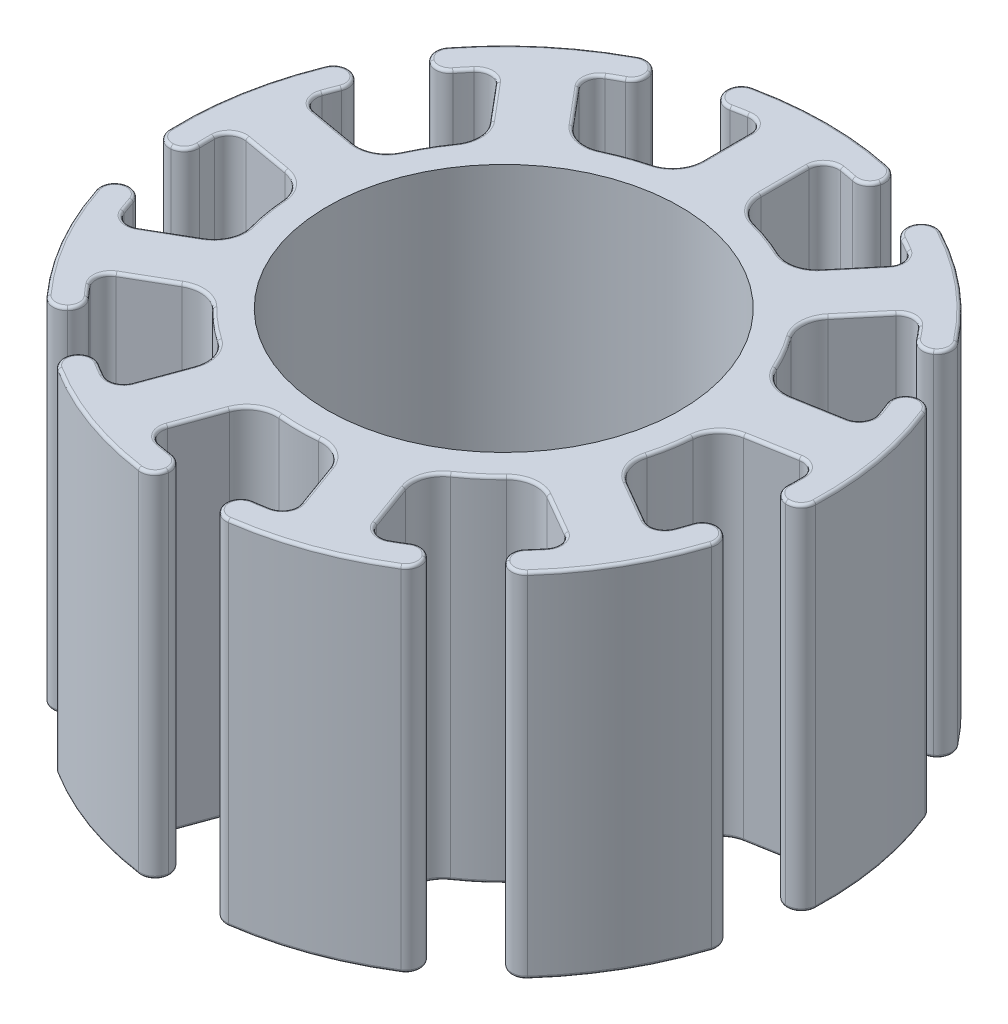
from build123d import *

# Parameters (mm, degrees)
SKETCH1_R                = 3.5
BOSS_EXTRUDE1_DEPTH      = 3
BOSS_EXTRUDE2_DEPTH      = 6
FILLET1_R                = 0.25
CIRPATTERN1_COUNT        = 9
FILLET1_OF_CIRPATTERN1_R = 0.25
FILLET2_R                = 0.5
SKETCH3_R                = 3
CUT_EXTRUDE1_DEPTH       = 10.823441352
FILLET3_R                = 0.05


with BuildPart() as part:
    # Sketch1 → Boss-Extrude1 (new, symmetric)
    with BuildSketch(Plane(origin=(0, 0, 0), x_dir=(1, 0, 0), z_dir=(0, 1, 0))):
        with Locations(Location((0, 0, 0), (0, 0, 270))):
            Circle(SKETCH1_R)
    extrude(amount=BOSS_EXTRUDE1_DEPTH, both=True)

    # Sketch2 → Boss-Extrude2 (add)
    with BuildSketch(Plane(origin=(0, 3, 0), x_dir=(1, 0, 0), z_dir=(0, 1, 0))):
        with BuildLine():
            Line((-1.4, 5.318834459), (-1.272727273, 4.835304053))
            ThreePointArc((-1.272727273, 4.835304053), (-0.88910902, 4.920313522), (-0.5, 4.974937186))
            Line((-0.5, 4.974937186), (-0.5, 3.464101615))
            ThreePointArc((-0.5, 3.464101615), (0, 3.5), (0.5, 3.464101615))
            Line((0.5, 3.464101615), (0.5, 4.974937186))
            ThreePointArc((0.5, 4.974937186), (0.88910902, 4.920313522), (1.272727273, 4.835304053))
            Line((1.272727273, 4.835304053), (1.4, 5.318834459))
            ThreePointArc((1.4, 5.318834459), (0, 5.5), (-1.4, 5.318834459))
        make_face()
    boss_extrude2 = extrude(amount=-BOSS_EXTRUDE2_DEPTH)

    # Fillet1
    fillet1_edges = [part.edges().sort_by_distance(p)[0] for p in [
        (-0.5, 0, -4.974937186),
        (0.5, 0, -4.974937186),
        (1.4, 0, -5.318834459),
        (1.272727273, 0, -4.835304053),
        (-1.4, 0, -5.318834459),
        (-1.272727273, 0, -4.835304053),
    ]]
    fillet(fillet1_edges, radius=FILLET1_R - 0.0001)  # a hair under: the kernel refuses the full size

    # CirPattern1: Boss-Extrude2 ×9 about axis
    cirpattern1_axis = Axis((0, 0, 0), (0, 1, 0))
    for i in range(1, CIRPATTERN1_COUNT):
        add(boss_extrude2.rotate(cirpattern1_axis, i * 360 / CIRPATTERN1_COUNT))

    # Fillet1 of CirPattern1
    fillet1_of_cirpattern1_edges = [part.edges().sort_by_distance(p)[0] for p in [
        (-3.580850203, 0, -3.489629181),
        (-2.81480576, 0, -4.132416791),
        (-2.346418668, 0, -4.974366235),
        (-2.13310788, 0, -4.522151122),
        (-4.491343108, 0, -3.174560927),
        (-4.083039189, 0, -2.88596448),
        (-4.9861808, 0, -0.3714849),
        (-4.812532622, 0, -1.356292653),
        (-4.994921963, 0, -2.302336765),
        (-4.540838148, 0, -2.093033423),
        (-5.481136861, 0, 0.455124943),
        (-4.982851692, 0, 0.413749948),
        (-4.058421985, 0, 2.920481295),
        (-4.558421985, 0, 2.054455891),
        (-5.30624576, 0, 1.446981664),
        (-4.823859782, 0, 1.315437876),
        (-3.90624576, 0, 3.871852795),
        (-3.551132509, 0, 3.519866177),
        (-1.231682419, 0, 4.845921834),
        (-2.17137504, 0, 4.50390169),
        (-3.134718193, 0, 4.519241291),
        (-2.849743812, 0, 4.108401174),
        (-0.503578855, 0, 5.476897693),
        (-0.457798959, 0, 4.978997903),
        (2.17137504, 0, 4.50390169),
        (1.231682419, 0, 4.845921834),
        (0.503578855, 0, 5.476897693),
        (0.457798959, 0, 4.978997903),
        (3.134718193, 0, 4.519241291),
        (2.849743812, 0, 4.108401174),
        (4.558421985, 0, 2.054455891),
        (4.058421985, 0, 2.920481295),
        (3.90624576, 0, 3.871852795),
        (3.551132509, 0, 3.519866177),
        (5.30624576, 0, 1.446981664),
        (4.823859782, 0, 1.315437876),
        (4.812532622, 0, -1.356292653),
        (4.9861808, 0, -0.3714849),
        (5.481136861, 0, 0.455124943),
        (4.982851692, 0, 0.413749948),
        (4.994921963, 0, -2.302336765),
        (4.540838148, 0, -2.093033423),
        (2.81480576, 0, -4.132416791),
        (3.580850203, 0, -3.489629181),
        (4.491343108, 0, -3.174560927),
        (4.083039189, 0, -2.88596448),
        (2.346418668, 0, -4.974366235),
        (2.13310788, 0, -4.522151122),
    ]]
    fillet(fillet1_of_cirpattern1_edges, radius=FILLET1_OF_CIRPATTERN1_R - 0.0001)  # a hair under: the kernel refuses the full size

    # Fillet2
    fillet2_edges = [part.edges().sort_by_distance(p)[0] for p in [
        (0.714946221, 0, 3.426200797),
        (1.654638841, 0, 3.084180654),
        (-1.654638841, 0, 3.084180654),
        (-0.714946221, 0, 3.426200797),
        (-3.25, 0, 1.299038106),
        (-2.75, 0, 2.165063509),
        (-3.324650039, 0, -1.093938809),
        (-3.498298217, 0, -0.109131056),
        (-1.843659375, 0, -2.975049598),
        (-2.609703818, 0, -2.332261988),
        (2.609703818, 0, -2.332261988),
        (1.843659375, 0, -2.975049598),
        (0.5, 0, -3.464101615),
        (-0.5, 0, -3.464101615),
        (3.498298217, 0, -0.109131056),
        (3.324650039, 0, -1.093938809),
        (2.75, 0, 2.165063509),
        (3.25, 0, 1.299038106),
    ]]
    fillet(fillet2_edges, radius=FILLET2_R)

    # Sketch3 → Cut-Extrude1 (cut, through all)
    with BuildSketch(Plane(origin=(0, 3, 0), x_dir=(1, 0, 0), z_dir=(0, 1, 0))):
        with Locations(Location((0, 0, 0), (0, 0, 270))):
            Circle(SKETCH3_R)
    extrude(amount=-CUT_EXTRUDE1_DEPTH, mode=Mode.SUBTRACT)

    # Fillet3
    fillet3_edges = [part.edges().sort_by_distance(p)[0] for p in [
        (2.458258553, -3, -4.353959679),
        (2.458258553, 3, -4.353959679),
        (2.369238886, 3, -3.601410867),
        (3.135283329, -3, -2.958623258),
        (3.86094113, -3, -3.176969246),
        (3.86094113, 3, -3.176969246),
        (3.535331853, 3, -4.213244437),
        (2.226050619, 3, -4.557364995),
        (2.384475912, 3, -4.873502399),
        (4.101578747, 3, -2.983610034),
        (4.38540305, 3, -3.194525175),
        (3.535331853, -3, -4.213244437),
        (2.226050619, -3, -4.557364995),
        (2.384475912, -3, -4.873502399),
        (4.101578747, -3, -2.983610034),
        (4.38540305, -3, -3.194525175),
        (2.687002501, 3, -4.11660775),
        (2.687002501, -3, -4.11660775),
        (3.58747414, 3, -3.36102233),
        (3.58747414, -3, -3.36102233),
        (4.681806639, -3, -1.755188479),
        (4.681806639, 3, -1.755188479),
        (4.129884566, 3, -1.235923382),
        (4.303532743, -3, -0.251115629),
        (4.999768966, -3, 0.048065484),
        (4.999768966, 3, 0.048065484),
        (5.416442642, 3, -0.955064977),
        (4.634671458, 3, -2.060266373),
        (4.959241479, 3, -2.20060786),
        (5.059819169, 3, 0.350866111),
        (5.412814838, 3, 0.371734485),
        (5.416442642, -3, -0.955064977),
        (4.634671458, -3, -2.060266373),
        (4.959241479, -3, -2.20060786),
        (5.059819169, -3, 0.350866111),
        (-0.915536031, -3, -4.915464757),
        (5.412814838, -3, 0.371734485),
        (4.70446779, 3, -1.426332576),
        (4.70446779, -3, -1.426332576),
        (4.908588139, 3, -0.268708551),
        (4.908588139, -3, -0.268708551),
        (-0.915536031, 3, -4.915464757),
        (4.714685366, -3, 1.664854918),
        (4.714685366, 3, 1.664854918),
        (3.958111359, 3, 1.707866389),
        (-0.5, 3, -4.281758182),
        (3.458111359, -3, 2.573891793),
        (3.799149336, -3, 3.250609839),
        (3.799149336, 3, 3.250609839),
        (4.763139721, 3, 2.75),
        (4.874678013, 3, 1.400853782),
        (5.213522843, 3, 1.501975554),
        (3.650513968, 3, 3.521168104),
        (3.907510407, 3, 3.764055448),
        (0.5, -3, -4.281758182),
        (4.763139721, -3, 2.75),
        (4.874678013, -3, 1.400853782),
        (5.213522843, -3, 1.501975554),
        (3.650513968, -3, 3.521168104),
        (3.907510407, -3, 3.764055448),
        (4.520660316, 3, 1.931339462),
        (4.520660316, -3, 1.931339462),
        (3.932919195, 3, 2.949336944),
        (3.932919195, -3, 2.949336944),
        (0.915536031, -3, -4.915464757),
        (0.915536031, 3, -4.915464757),
        (2.541510413, -3, 4.305894195),
        (2.541510413, 3, 4.305894195),
        (1.934293858, 3, 3.852526496),
        (0.994601237, -3, 4.19454664),
        (0.820865509, -3, 4.932157724),
        (0.820865509, 3, 4.932157724),
        (1.881110788, 3, 5.168309414),
        (2.83376855, 3, 4.206498883),
        (0, 3, -5.5),
        (3.028338927, 3, 4.501767913),
        (0.533092711, 3, 5.043876407),
        (0.57383843, 3, 5.395133034),
        (1.881110788, -3, 5.168309414),
        (2.83376855, -3, 4.206498883),
        (3.028338927, -3, 4.501767913),
        (0.533092711, -3, 5.043876407),
        (0.57383843, -3, 5.395133034),
        (-1.224164045, 3, -4.922021886),
        (2.221585638, 3, 4.385316301),
        (2.221585638, -3, 4.385316301),
        (1.11699365, 3, 4.787354906),
        (1.11699365, -3, 4.787354906),
        (-1.306012436, 3, -5.266031003),
        (1.224164045, 3, -4.922021886),
        (1.306012436, 3, -5.266031003),
        (-0.820865509, -3, 4.932157724),
        (-0.820865509, 3, 4.932157724),
        (-0.994601237, 3, 4.19454664),
        (-1.934293858, -3, 3.852526496),
        (0, -3, -5.5),
        (-2.541510413, -3, 4.305894195),
        (-2.541510413, 3, 4.305894195),
        (-1.881110788, 3, 5.168309414),
        (-0.533092711, 3, 5.043876407),
        (-0.57383843, 3, 5.395133034),
        (-2.83376855, 3, 4.206498883),
        (-3.028338927, 3, 4.501767913),
        (-1.881110788, -3, 5.168309414),
        (-0.533092711, -3, 5.043876407),
        (-0.57383843, -3, 5.395133034),
        (-2.83376855, -3, 4.206498883),
        (-3.028338927, -3, 4.501767913),
        (-1.11699365, 3, 4.787354906),
        (-1.11699365, -3, 4.787354906),
        (-2.221585638, 3, 4.385316301),
        (-2.221585638, -3, 4.385316301),
        (-1.224164045, -3, -4.922021886),
        (-1.306012436, -3, -5.266031003),
        (1.224164045, -3, -4.922021886),
        (-3.799149336, -3, 3.250609839),
        (-3.799149336, 3, 3.250609839),
        (-3.458111359, 3, 2.573891793),
        (-3.958111359, -3, 1.707866389),
        (1.306012436, -3, -5.266031003),
        (-4.714685366, -3, 1.664854918),
        (-4.714685366, 3, 1.664854918),
        (-4.763139721, 3, 2.75),
        (-3.650513968, 3, 3.521168104),
        (-3.907510407, 3, 3.764055448),
        (-4.874678013, 3, 1.400853782),
        (-0.587741121, 3, -4.880676406),
        (-5.213522843, 3, 1.501975554),
        (-4.763139721, -3, 2.75),
        (-3.650513968, -3, 3.521168104),
        (-3.907510407, -3, 3.764055448),
        (-0.587741121, -3, -4.880676406),
        (-4.874678013, -3, 1.400853782),
        (-5.213522843, -3, 1.501975554),
        (-3.932919195, 3, 2.949336944),
        (-3.932919195, -3, 2.949336944),
        (-4.520660316, 3, 1.931339462),
        (-4.520660316, -3, 1.931339462),
        (0.587741121, 3, -4.880676406),
        (0.587741121, -3, -4.880676406),
        (-4.999768966, -3, 0.048065484),
        (-4.999768966, 3, 0.048065484),
        (-4.303532743, 3, -0.251115629),
        (-4.129884566, -3, -1.235923382),
        (-4.681806639, -3, -1.755188479),
        (-4.681806639, 3, -1.755188479),
        (-5.416442642, 3, -0.955064977),
        (-5.059819169, 3, 0.350866111),
        (-5.412814838, 3, 0.371734485),
        (-4.634671458, 3, -2.060266373),
        (-4.959241479, 3, -2.20060786),
        (-5.416442642, -3, -0.955064977),
        (-5.059819169, -3, 0.350866111),
        (-5.412814838, -3, 0.371734485),
        (-4.634671458, -3, -2.060266373),
        (-4.959241479, -3, -2.20060786),
        (-4.908588139, 3, -0.268708551),
        (-4.908588139, -3, -0.268708551),
        (-4.70446779, 3, -1.426332576),
        (-4.70446779, -3, -1.426332576),
        (-3.86094113, -3, -3.176969246),
        (-3.86094113, 3, -3.176969246),
        (-3.135283329, 3, -2.958623258),
        (-2.369238886, -3, -3.601410867),
        (-2.458258553, -3, -4.353959679),
        (-2.458258553, 3, -4.353959679),
        (-3.535331853, 3, -4.213244437),
        (-4.101578747, 3, -2.983610034),
        (-4.38540305, 3, -3.194525175),
        (-2.226050619, 3, -4.557364995),
        (-2.384475912, 3, -4.873502399),
        (-3.535331853, -3, -4.213244437),
        (-4.101578747, -3, -2.983610034),
        (-4.38540305, -3, -3.194525175),
        (-2.226050619, -3, -4.557364995),
        (-2.384475912, -3, -4.873502399),
        (-3.58747414, 3, -3.36102233),
        (-3.58747414, -3, -3.36102233),
        (-2.687002501, 3, -4.11660775),
        (-2.687002501, -3, -4.11660775),
        (-1.197070502, -3, -3.288924173),
        (-1.197070502, 3, -3.288924173),
        (-2.369238886, 3, -3.601410867),
        (-3.135283329, -3, -2.958623258),
        (-3.031088913, 3, -1.75),
        (-3.031088913, -3, -1.75),
        (-4.129884566, 3, -1.235923382),
        (-4.303532743, -3, -0.251115629),
        (-3.446827136, 3, 0.607768622),
        (-3.446827136, -3, 0.607768622),
        (-3.958111359, 3, 1.707866389),
        (-3.458111359, -3, 2.573891793),
        (-2.249756634, 3, 2.681155551),
        (-2.249756634, -3, 2.681155551),
        (-1.934293858, 3, 3.852526496),
        (-0.994601237, -3, 4.19454664),
        (0, 3, 3.5),
        (0, -3, 3.5),
        (0.994601237, 3, 4.19454664),
        (1.934293858, -3, 3.852526496),
        (2.249756634, 3, 2.681155551),
        (2.249756634, -3, 2.681155551),
        (3.458111359, 3, 2.573891793),
        (3.446827136, 3, 0.607768622),
        (3.446827136, -3, 0.607768622),
        (4.303532743, 3, -0.251115629),
        (1.197070502, 3, -3.288924173),
        (1.197070502, -3, -3.288924173),
        (0.5, 3, -4.281758182),
        (3.031088913, 3, -1.75),
        (3.031088913, -3, -1.75),
        (3.135283329, 3, -2.958623258),
        (3.958111359, -3, 1.707866389),
        (4.129884566, -3, -1.235923382),
        (2.369238886, -3, -3.601410867),
        (-0.5, -3, -4.281758182),
        (-1.829454211, 3, -3.121028617),
        (-1.829454211, -3, -3.121028617),
        (-2.75593179, 3, -2.343621623),
        (-2.75593179, -3, -2.343621623),
        (-3.407601757, 3, -1.21489613),
        (-3.407601757, -3, -1.21489613),
        (-3.617617174, 3, -0.023839513),
        (-3.617617174, -3, -0.023839513),
        (-3.39129457, 3, 1.259699759),
        (-3.39129457, -3, 1.259699759),
        (-2.786579277, 3, 2.30709737),
        (-2.786579277, -3, 2.30709737),
        (-1.788162963, 3, 3.14486813),
        (-1.788162963, -3, 3.14486813),
        (-0.651669967, 3, 3.558517752),
        (-0.651669967, -3, 3.558517752),
        (0.651669967, 3, 3.558517752),
        (0.651669967, -3, 3.558517752),
        (1.788162963, 3, 3.14486813),
        (1.788162963, -3, 3.14486813),
        (2.786579277, 3, 2.30709737),
        (2.786579277, -3, 2.30709737),
        (3.617617174, 3, -0.023839513),
        (3.617617174, -3, -0.023839513),
        (0.604715292, 3, -3.566797128),
        (0.604715292, -3, -3.566797128),
        (2.75593179, 3, -2.343621623),
        (2.75593179, -3, -2.343621623),
        (3.39129457, 3, 1.259699759),
        (3.39129457, -3, 1.259699759),
        (3.407601757, 3, -1.21489613),
        (3.407601757, -3, -1.21489613),
        (1.829454211, 3, -3.121028617),
        (1.829454211, -3, -3.121028617),
        (-0.604715292, 3, -3.566797128),
        (-0.604715292, -3, -3.566797128),
    ]]
    fillet(fillet3_edges, radius=FILLET3_R)


solid = part.part
